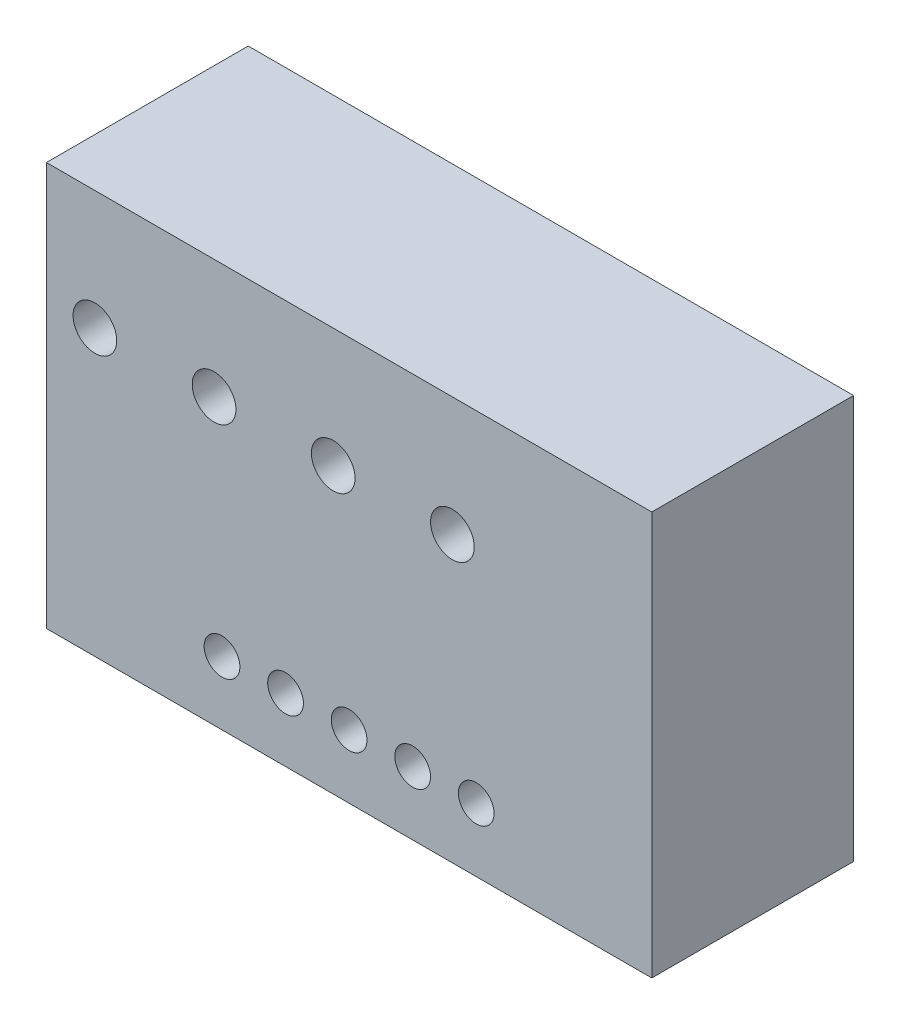
from build123d import *

# Parameters (mm, degrees)
SKETCH1_W            = 76.2
SKETCH1_H            = 50.8
BOSS_EXTRUDE1_DEPTH  = 25.4
M4_CLEARANCE_HOLE1_D = 4.5
M5_CLEARANCE_HOLE1_D = 5.5


with BuildPart() as part:
    # Sketch1 → Boss-Extrude1 (new body)
    with BuildSketch(Plane.XY):
        Rectangle(SKETCH1_W, SKETCH1_H)
    extrude(amount=BOSS_EXTRUDE1_DEPTH)

    # M4 Clearance Hole1 (through all)
    with Locations(Plane.XY.offset(25.4)):
        with Locations((-16, -17.4), (-8, -17.4), (0, -17.4), (8, -17.4), (16, -17.4)):
            Hole(M4_CLEARANCE_HOLE1_D / 2)

    # M5 Clearance Hole1 (through all)
    with Locations(Plane.XY.offset(25.4)):
        with Locations((-32, 10.4), (-17, 10.4), (-2, 10.4), (13, 10.4)):
            Hole(M5_CLEARANCE_HOLE1_D / 2)


solid = part.part
